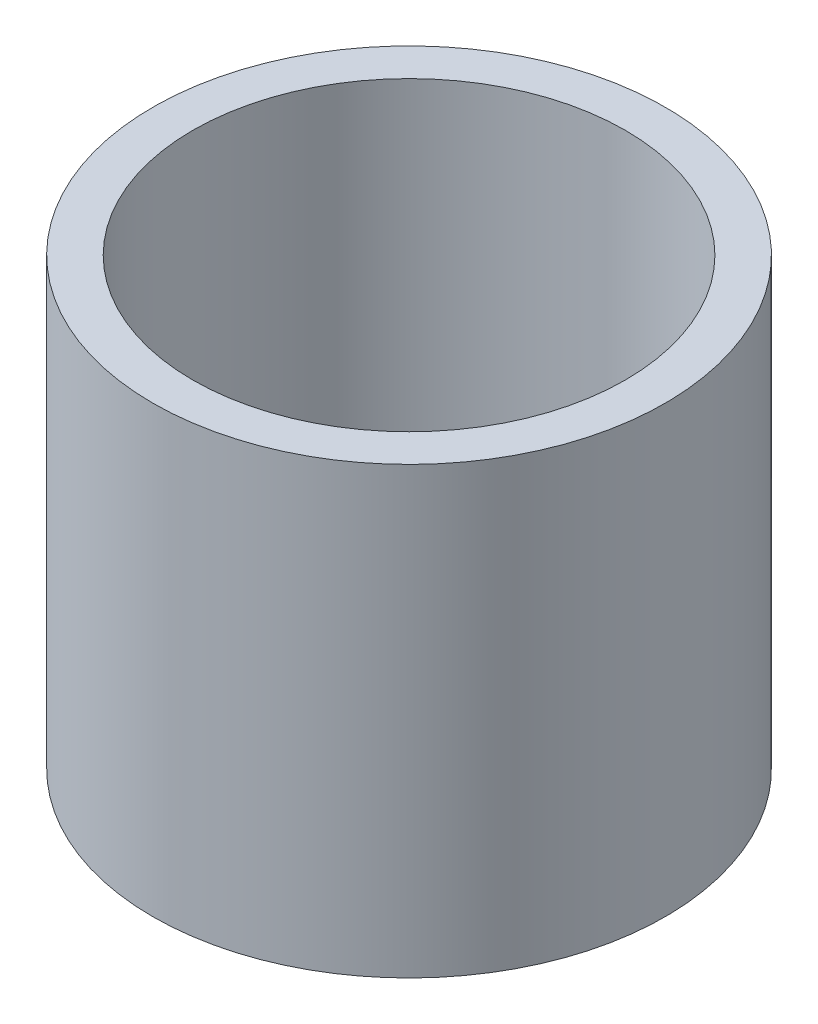
from build123d import *

# Parameters (mm, degrees)
SKETCH1_R           = 27.5
BOSS_EXTRUDE1_DEPTH = 47.728351062
SKETCH2_R           = 23.208909754
CUT_EXTRUDE1_DEPTH  = 62.56700005


with BuildPart() as part:
    # Sketch1 → Boss-Extrude1 (new body)
    with BuildSketch(Plane(origin=(0, 0, 0), x_dir=(1, 0, 0), z_dir=(0, 1, 0))):
        Circle(SKETCH1_R)
    extrude(amount=BOSS_EXTRUDE1_DEPTH)

    # Sketch2 → Cut-Extrude1 (cut, through all)
    with BuildSketch(Plane(origin=(0, 0, 0), x_dir=(1, 0, 0), z_dir=(0, 1, 0))):
        Circle(SKETCH2_R)
    extrude(amount=CUT_EXTRUDE1_DEPTH, mode=Mode.SUBTRACT)


solid = part.part
